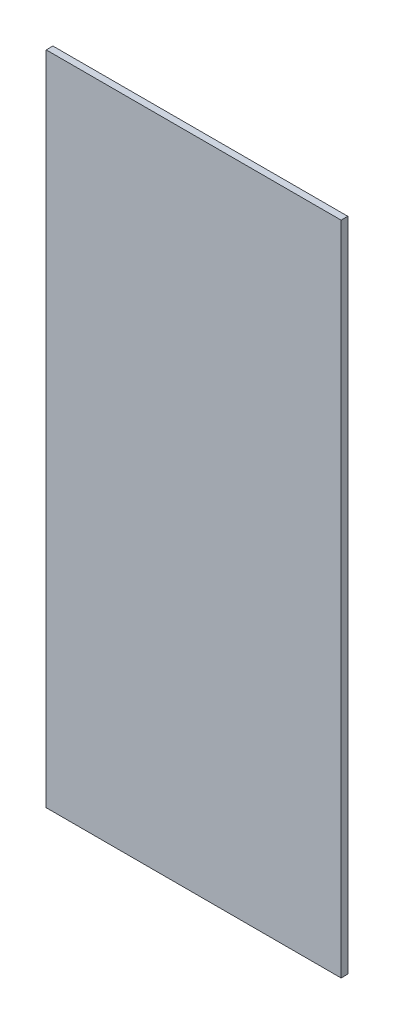
from build123d import *

# Parameters (mm, degrees)
SKETCH1_W      = 176.4
SKETCH1_H      = 392.6
EXTRUDE1_DEPTH = 4


with BuildPart() as part:
    # Sketch1 → Extrude1 (new body)
    with BuildSketch(Plane.XY):
        with Locations((0, -196.3)):
            Rectangle(SKETCH1_W, SKETCH1_H)
    extrude(amount=EXTRUDE1_DEPTH)


solid = part.part
